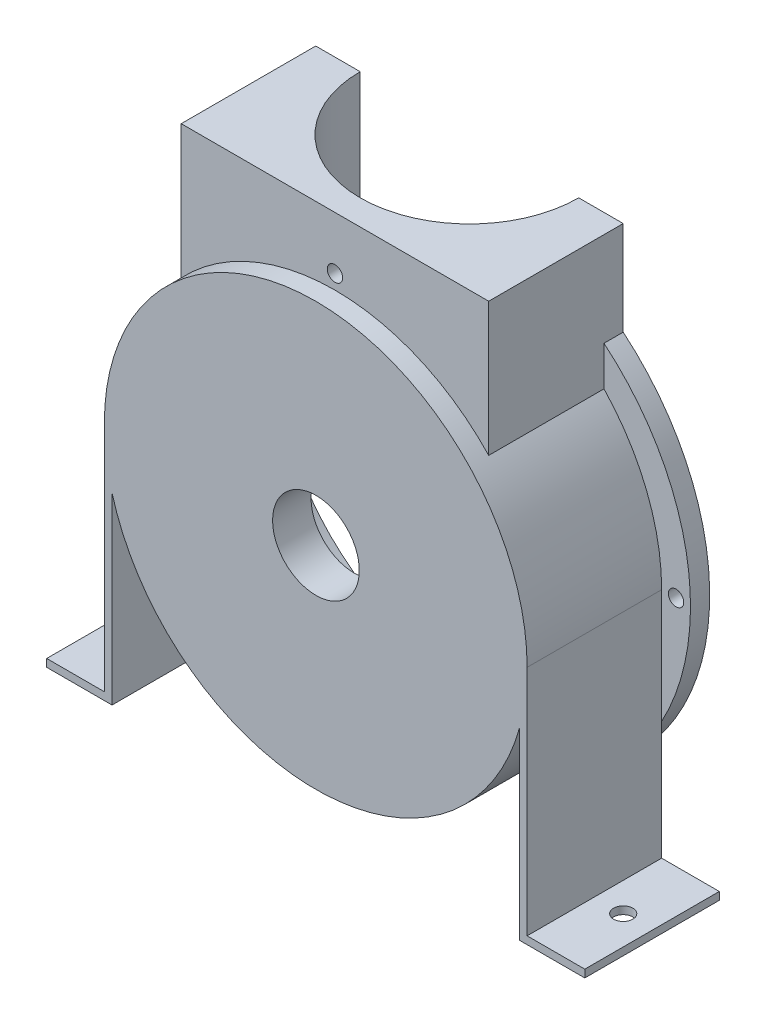
from build123d import *
from OCP.BRepAlgoAPI import BRepAlgoAPI_Cut
from OCP.TopTools import TopTools_ListOfShape

# Parameters (mm, degrees)
SKETCH1_W           = 200
SKETCH1_H           = 135
BOSS_EXTRUDE1_DEPTH = 40
CUT_EXTRUDE2_DEPTH  = 40
CUT_EXTRUDE3_DEPTH  = 35
CUT_EXTRUDE4_DEPTH  = 5
SKETCH9_R           = 50
CUT_EXTRUDE5_DEPTH  = 28.2
BOSS_EXTRUDE2_DEPTH = 35
CUT_EXTRUDE6_DEPTH  = 35
SKETCH15_R          = 2
CUT_EXTRUDE8_DEPTH  = 35
CIRPATTERN1_COUNT   = 4
SKETCH16_R          = 2.5
CUT_EXTRUDE9_DEPTH  = 35
SKETCH17_R          = 30.2
CUT_EXTRUDE10_DEPTH = 38
BOSS_EXTRUDE3_DEPTH = 34
SKETCH19_R          = 28.43
CUT_EXTRUDE11_DEPTH = 41
SKETCH20_R          = 51
CUT_EXTRUDE12_DEPTH = 30
SCALE6_SCALE        = 1.33
SKETCH23_R          = 15
CUT_EXTRUDE15_DEPTH = 252.625115315


with BuildPart() as part:
    # Sketch1 → Boss-Extrude1 (new body)
    with BuildSketch(Plane.XY):
        with Locations((100, 67.5)):
            Rectangle(SKETCH1_W, SKETCH1_H)
    extrude(amount=BOSS_EXTRUDE1_DEPTH)

    # Sketch6 → Cut-Extrude2 (cut)
    with BuildSketch(Plane.XY.offset(40)):
        with BuildLine():
            Line((0, 0), (100, 0))
            ThreePointArc((100, 0), (41.230473516, 41.230473516), (60, 110.523431781))
            Line((60, 110.523431781), (60, 135))
            Line((60, 135), (0, 135))
            Line((0, 135), (0, 0))
        make_face()
        with BuildLine():
            ThreePointArc((140, 110.523431781), (158.769526484, 41.230473516), (100, 0))
            Line((100, 0), (200, 0))
            Line((200, 0), (200, 135))
            Line((200, 135), (140, 135))
            Line((140, 135), (140, 110.523431781))
        make_face()
    extrude(amount=-CUT_EXTRUDE2_DEPTH, mode=Mode.SUBTRACT)

    # Sketch7 → Cut-Extrude3 (cut)
    with BuildSketch(Plane.XY.offset(40)):
        with BuildLine():
            ThreePointArc((155, 62.5), (79.689903988, 11.387379249), (60, 100.249172176))
            Line((60, 100.249172176), (60, 110.523431781))
            ThreePointArc((60, 110.523431781), (100, 0), (140, 110.523431781))
            Line((140, 110.523431781), (140, 100.249172176))
            ThreePointArc((140, 100.249172176), (151.112620751, 82.810096012), (155, 62.5))
        make_face()
    extrude(amount=-CUT_EXTRUDE3_DEPTH, mode=Mode.SUBTRACT)

    # Sketch8 → Cut-Extrude4 (cut)
    with BuildSketch(Plane.XY.offset(40)):
        with BuildLine():
            Line((60, 135), (60, 100.249172176))
            ThreePointArc((60, 100.249172176), (100, 117.5), (140, 100.249172176))
            Line((140, 100.249172176), (140, 135))
            Line((140, 135), (60, 135))
        make_face()
    extrude(amount=-CUT_EXTRUDE4_DEPTH, mode=Mode.SUBTRACT)

    # Sketch9 → Cut-Extrude5 (cut)
    with BuildSketch(Plane(origin=(0, 0, 0), x_dir=(-1, 0, 0), z_dir=(0, 0, -1))):
        with Locations((-100, 62.5)):
            Circle(SKETCH9_R)
    extrude(amount=-CUT_EXTRUDE5_DEPTH, mode=Mode.SUBTRACT)

    # Sketch10 → Boss-Extrude2 (add)
    with BuildSketch(Plane.XY.offset(40)):
        with BuildLine():
            Line((155, 2), (155, 62.5))
            ThreePointArc((155, 62.5), (154.497706374, 55.083801513), (153, 47.803061543))
            Line((153, 47.803061543), (153, 0))
            Line((153, 0), (170, 0))
            Line((170, 0), (170, 2))
            Line((170, 2), (155, 2))
        make_face()
        with BuildLine():
            ThreePointArc((47, 47.803061543), (45.502293626, 55.083801513), (45, 62.5))
            Line((45, 62.5), (45, 2))
            Line((45, 2), (30, 2))
            Line((30, 2), (30, 0))
            Line((30, 0), (47, 0))
            Line((47, 0), (47, 47.803061543))
        make_face()
    extrude(amount=-BOSS_EXTRUDE2_DEPTH)

    # Sketch12 → Cut-Extrude6 (cut)
    with BuildSketch(Plane(origin=(0, 135, 0), x_dir=(1, 0, 0), z_dir=(0, 1, 0))):
        with BuildLine():
            ThreePointArc((71.8, 0), (100, -28.2), (128.2, 0))
            Line((128.2, 0), (71.8, 0))
        make_face()
    extrude(amount=-CUT_EXTRUDE6_DEPTH, mode=Mode.SUBTRACT)

    # Sketch15 → Cut-Extrude8 (cut)
    with BuildSketch(Plane(origin=(0, 0, 0), x_dir=(-1, 0, 0), z_dir=(0, 0, -1))):
        with Locations((-41.25, 62.5)):
            Circle(SKETCH15_R)
    cut_extrude8 = extrude(amount=-CUT_EXTRUDE8_DEPTH, mode=Mode.SUBTRACT)

    # CirPattern1: Cut-Extrude8 ×4 about axis
    cirpattern1_axis = Axis((100, 62.5, 5), (0, 0, 1))
    for i in range(1, CIRPATTERN1_COUNT):
        add(cut_extrude8.rotate(cirpattern1_axis, i * 360 / CIRPATTERN1_COUNT), mode=Mode.SUBTRACT)

    # Sketch16 → Cut-Extrude9 (cut)
    with BuildSketch(Plane(origin=(0, 2, 0), x_dir=(1, 0, 0), z_dir=(0, 1, 0))):
        with Locations((162.5, -22.5)):
            Circle(SKETCH16_R)
        with Locations((37.5, -22.5)):
            Circle(SKETCH16_R)
    extrude(amount=-CUT_EXTRUDE9_DEPTH, mode=Mode.SUBTRACT)

    # Sketch17 → Cut-Extrude10 (cut)
    with BuildSketch(Plane(origin=(0, 135, 0), x_dir=(1, 0, 0), z_dir=(0, 1, 0))):
        with Locations((100, 0)):
            Circle(SKETCH17_R)
    extrude(amount=-CUT_EXTRUDE10_DEPTH, mode=Mode.SUBTRACT)

    # Sketch18 → Boss-Extrude3 (add)
    with BuildSketch(Plane(origin=(0, 135, 0), x_dir=(1, 0, 0), z_dir=(0, 1, 0))):
        with BuildLine():
            Line((130.2, 0), (69.8, 0))
            ThreePointArc((69.8, 0), (100, -30.2), (130.2, 0))
        make_face()
    extrude(amount=-BOSS_EXTRUDE3_DEPTH)

    # Sketch19 → Cut-Extrude11 (cut)
    with BuildSketch(Plane(origin=(0, 135, 0), x_dir=(1, 0, 0), z_dir=(0, 1, 0))):
        with Locations((100, 0)):
            Circle(SKETCH19_R)
    extrude(amount=-CUT_EXTRUDE11_DEPTH, mode=Mode.SUBTRACT)

    # Sketch20 → Cut-Extrude12 (cut)
    with BuildSketch(Plane(origin=(0, 0, 0), x_dir=(-1, 0, 0), z_dir=(0, 0, -1))):
        with Locations((-100, 62.5)):
            Circle(SKETCH20_R)
    extrude(amount=-CUT_EXTRUDE12_DEPTH, mode=Mode.SUBTRACT)


with BuildPart() as part_1:
    # Scale6: scaled about (99.999974033, 70.397501302, 26.101442821)
    add(part.part.scale(SCALE6_SCALE).moved(Location((-32.999991431, -23.23117543, -8.613476131))))


with BuildPart() as cut_extrude15_tool:
    # Sketch23 → Cut-Extrude15 (new, through all)
    with BuildSketch(Plane(origin=(0, 0, 31.286528804), x_dir=(-1, 0, 0), z_dir=(0, 0, -1))):
        with Locations((-100.069201604, 59.906371454)):
            Circle(SKETCH23_R)
    extrude(amount=-CUT_EXTRUDE15_DEPTH)


with BuildPart() as part_2:
    add(part_1.part)

    # Cut-Extrude15: cut by cut_extrude15_tool, with a tolerance
    cut_extrude15_stock = TopTools_ListOfShape()
    cut_extrude15_stock.Append(part_2.part.wrapped)
    cut_extrude15_tools = TopTools_ListOfShape()
    cut_extrude15_tools.Append(cut_extrude15_tool.part.wrapped)
    cut_extrude15_cut = BRepAlgoAPI_Cut()
    cut_extrude15_cut.SetArguments(cut_extrude15_stock)
    cut_extrude15_cut.SetTools(cut_extrude15_tools)
    cut_extrude15_cut.SetFuzzyValue(0.00001)
    cut_extrude15_cut.Build()
    add(Compound.cast(cut_extrude15_cut.Shape()).solids(), mode=Mode.REPLACE)


solid = part_2.part
